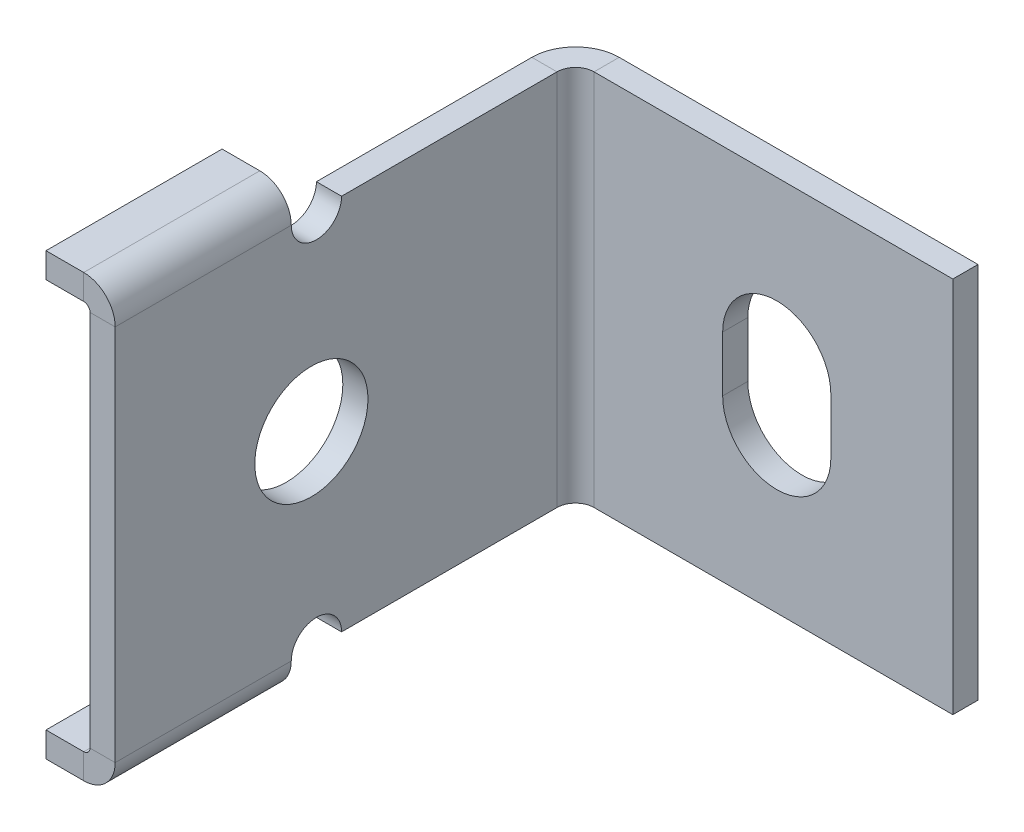
from build123d import *

# Parameters (mm, degrees)
BASE_FLANGE_DEPTH        = 7.5
NOTCH_CUT_DEPTH          = 26.568339797
EDGE_FLANGE1_DEPTH       = 7
M4_CLEARANCE_SLOT1_DEPTH = 1
HOLE1_OUTLINE_R          = 2.25
HOLE1_DEPTH              = 1


# Read off the part's stored shape, not the designer's step: M4 Clearance Slot1, Hole1
# Sheet-metal steps are written as plain solids
with BuildPart() as part:
    # Profile Sketch → Base Flange (new, symmetric)
    with BuildSketch(Plane(origin=(171.772586935, 0, 3.13889728), x_dir=(-1, 0, 0), z_dir=(0, 1, 0))):
        with BuildLine():
            Line((155.772586935, -3.13889728), (170.035986935, -3.13889728))
            ThreePointArc((170.035986935, -3.13889728), (171.263948571, -2.630258916), (171.772586935, -1.40229728))
            Line((171.772586935, -1.40229728), (171.772586935, 16.16110272))
            Line((171.772586935, 16.16110272), (170.772586935, 16.16110272))
            Line((170.772586935, 16.16110272), (170.772586935, -1.40229728))
            ThreePointArc((170.772586935, -1.40229728), (170.55684179, -1.923152135), (170.035986935, -2.13889728))
            Line((170.035986935, -2.13889728), (155.772586935, -2.13889728))
            Line((155.772586935, -2.13889728), (155.772586935, -3.13889728))
        make_face()
    extrude(amount=BASE_FLANGE_DEPTH, both=True)

    # Sketch1 → Notch Cut (cut, symmetric)
    with BuildSketch(Plane(origin=(1, 0, 0), x_dir=(0, 0, -1), z_dir=(1, 0, 0))):
        with BuildLine():
            Line((-10.3, -56.296391585), (-10.3, -7.5))
            ThreePointArc((-10.3, -7.5), (-11.3, -6.5), (-12.3, -7.5))
            Line((-12.3, -7.5), (-12.3, -56.296391585))
            Line((-12.3, -56.296391585), (-12.3, -153.889174754))
            Line((-12.3, -153.889174754), (-10.3, -153.889174754))
            Line((-10.3, -153.889174754), (-10.3, -56.296391585))
        make_face()
    notch_cut = extrude(amount=NOTCH_CUT_DEPTH, both=True, mode=Mode.SUBTRACT)

    # Edge-Flange1 section (across the edge) → Edge-Flange1 (add)
    with BuildSketch(Plane(origin=(0, -7.75, 12.3), x_dir=(0, 1, 0), z_dir=(0, 0, 1))):
        with BuildLine():
            Line((-1, 0.25), (-1, 1.75))
            Line((-1, 1.75), (0, 1.75))
            Line((0, 1.75), (0, 0.25))
            ThreePointArc((0, 0.25), (0.073223305, 0.073223305), (0.25, 0))
            Line((0.25, 0), (0.25, -1))
            ThreePointArc((0.25, -1), (-0.633883476, -0.633883476), (-1, 0.25))
        make_face()
    edge_flange1 = extrude(amount=EDGE_FLANGE1_DEPTH)

    # Alignment Tab Mirror: Notch Cut, Edge-Flange1 across plane
    add(notch_cut.mirror(Plane.ZX), mode=Mode.SUBTRACT)
    add(edge_flange1.mirror(Plane.ZX))

    # M4 Clearance Slot1 outline → M4 Clearance Slot1 (cut)
    with BuildSketch(Plane.XY):
        with BuildLine():
            Line((11.15, -1.1), (11.15, 1.1))
            ThreePointArc((11.15, 1.1), (9, 3.25), (6.85, 1.1))
            Line((6.85, 1.1), (6.85, -1.1))
            ThreePointArc((6.85, -1.1), (9, -3.25), (11.15, -1.1))
        make_face()
    extrude(amount=M4_CLEARANCE_SLOT1_DEPTH, mode=Mode.SUBTRACT)

    # Hole1 outline → Hole1 (cut)
    with BuildSketch(Plane.YZ):
        with Locations((0, 11.5)):
            Circle(HOLE1_OUTLINE_R)
    extrude(amount=HOLE1_DEPTH, mode=Mode.SUBTRACT)


solid = part.part
